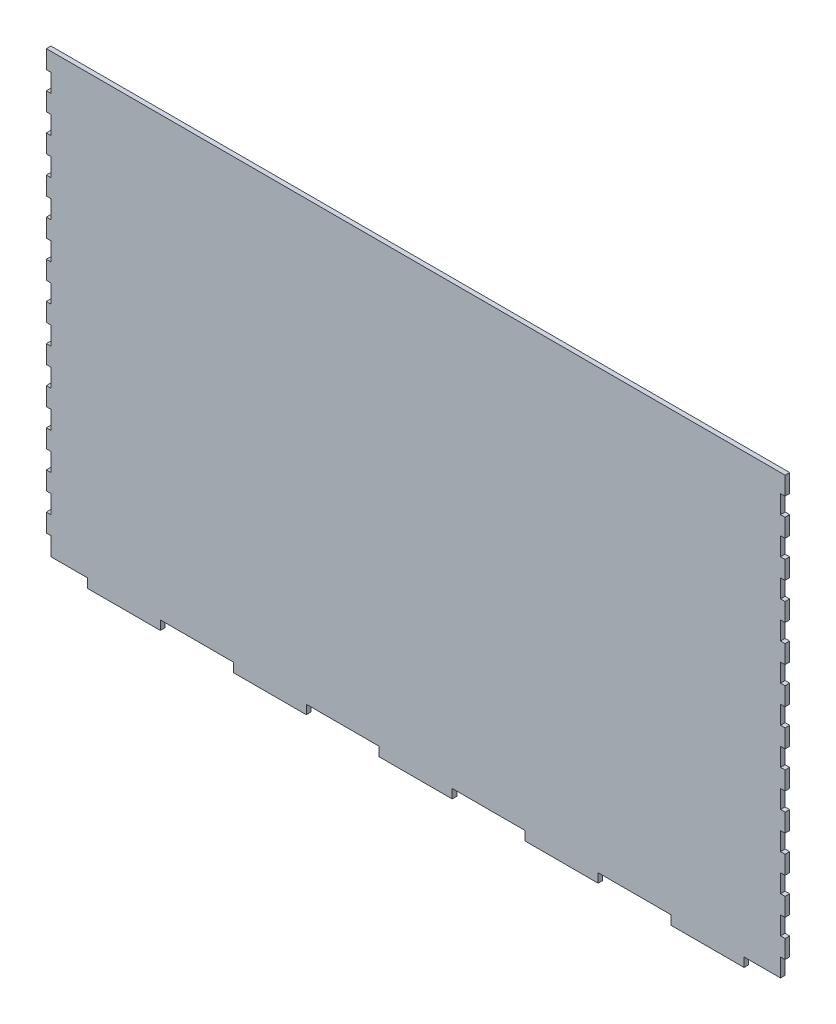
from build123d import *

# Parameters (mm, degrees)
BOSS_EXTRUDE1_DEPTH = 3.175


with BuildPart() as part:
    # Sketch1 → Boss-Extrude1 (new body)
    with BuildSketch(Plane.XY):
        Polygon((0, 12.7), (0, 0), (25.4, 0), (25.4, -6.35), (76.2, -6.35), (76.2, 0), (127, 0), (127, -6.35), (177.8, -6.35), (177.8, 0), (228.6, 0), (228.6, -6.35), (279.4, -6.35), (279.4, 0), (330.2, 0), (330.2, -6.35), (381, -6.35), (381, 0), (431.8, 0), (431.8, -6.35), (482.6, -6.35), (482.6, 0), (508, 0), (508, 12.7), (511.175, 12.7), (511.175, 25.4), (508, 25.4), (508, 38.1), (511.175, 38.1), (511.175, 50.8), (508, 50.8), (508, 63.5), (511.175, 63.5), (511.175, 76.2), (508, 76.2), (508, 88.9), (511.175, 88.9), (511.175, 101.6), (508, 101.6), (508, 114.3), (511.175, 114.3), (511.175, 127), (508, 127), (508, 139.7), (511.175, 139.7), (511.175, 152.4), (508, 152.4), (508, 165.1), (511.175, 165.1), (511.175, 177.8), (508, 177.8), (508, 190.5), (511.175, 190.5), (511.175, 203.2), (508, 203.2), (508, 215.9), (511.175, 215.9), (511.175, 228.6), (508, 228.6), (508, 241.3), (511.175, 241.3), (511.175, 254), (508, 254), (508, 266.7), (511.175, 266.7), (511.175, 279.4), (508, 279.4), (508, 292.1), (511.175, 292.1), (511.175, 304.8), (-3.175, 304.8), (-3.175, 292.1), (0, 292.1), (0, 279.4), (-3.175, 279.4), (-3.175, 266.7), (0, 266.7), (0, 254), (-3.175, 254), (-3.175, 241.3), (0, 241.3), (0, 228.6), (-3.175, 228.6), (-3.175, 215.9), (0, 215.9), (0, 203.2), (-3.175, 203.2), (-3.175, 190.5), (0, 190.5), (0, 177.8), (-3.175, 177.8), (-3.175, 165.1), (0, 165.1), (0, 152.4), (-3.175, 152.4), (-3.175, 139.7), (0, 139.7), (0, 127), (-3.175, 127), (-3.175, 114.3), (0, 114.3), (0, 101.6), (-3.175, 101.6), (-3.175, 88.9), (0, 88.9), (0, 76.2), (-3.175, 76.2), (-3.175, 63.5), (0, 63.5), (0, 50.8), (-3.175, 50.8), (-3.175, 38.1), (0, 38.1), (0, 25.4), (-3.175, 25.4), (-3.175, 12.7), align=None)
    extrude(amount=BOSS_EXTRUDE1_DEPTH)


solid = part.part
